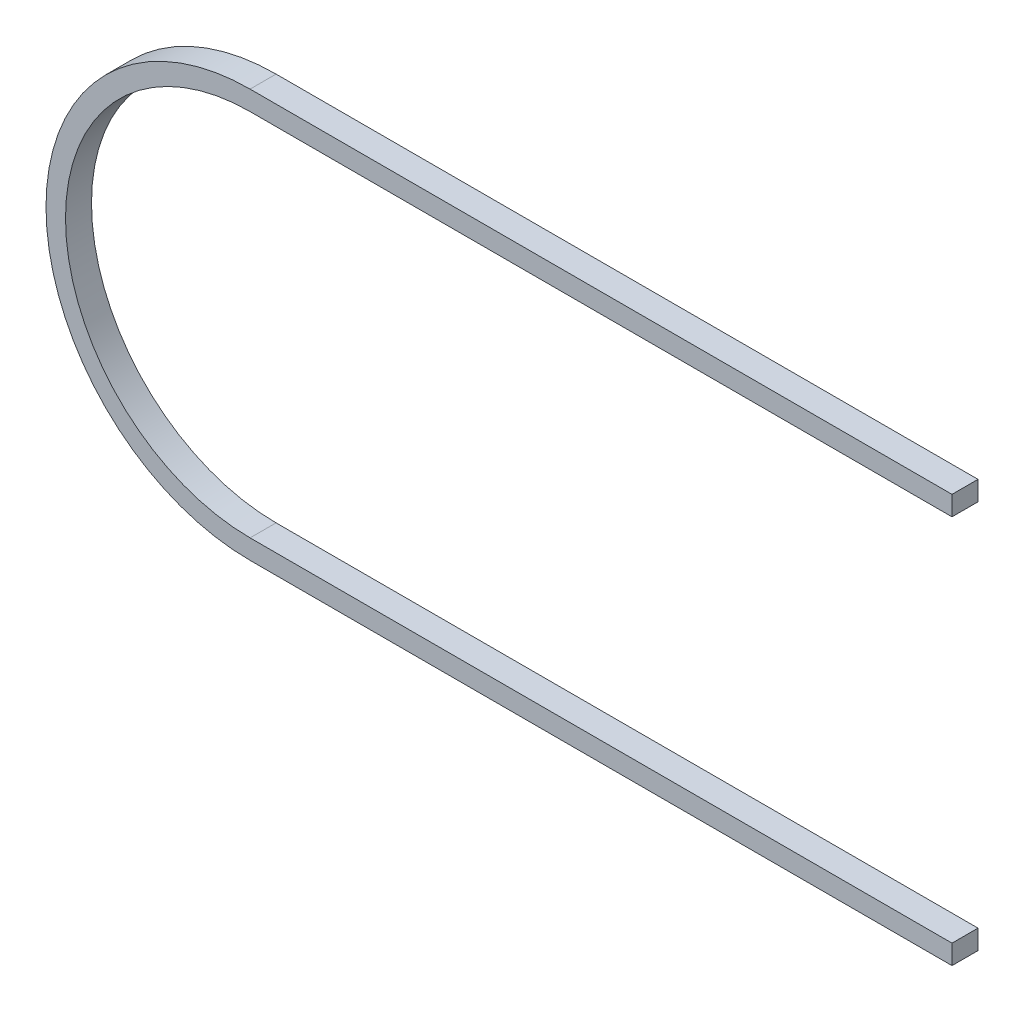
from build123d import *

# Parameters (mm, degrees)
BOSS_EXTRUDE1_DEPTH = 2.54


with BuildPart() as part:
    # Sketch1 → Boss-Extrude1 (new body)
    with BuildSketch(Plane.XY):
        with BuildLine():
            Line((0, 19.939), (68.58, 19.939))
            Line((68.58, 19.939), (68.58, 18.034))
            Line((68.58, 18.034), (0, 18.034))
            ThreePointArc((0, 18.034), (-18.034, 0), (0, -18.034))
            Line((0, -18.034), (68.58, -18.034))
            Line((68.58, -18.034), (68.58, -19.939))
            Line((68.58, -19.939), (0, -19.939))
            ThreePointArc((0, -19.939), (-19.939, 0), (0, 19.939))
        make_face()
    extrude(amount=BOSS_EXTRUDE1_DEPTH)


solid = part.part
